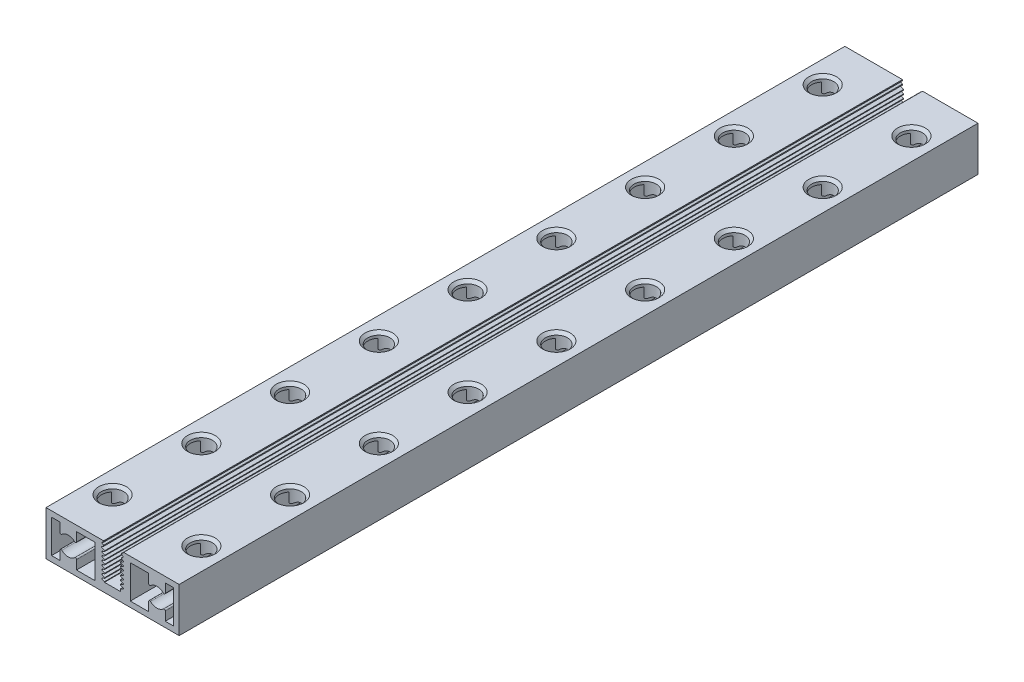
from build123d import *

# Parameters (mm, degrees)
SKETCH1_W                    = 24
SKETCH1_H                    = 144
BOSS_EXTRUDE1_DEPTH          = 8
CUT_EXTRUDE1_DEPTH           = 145.720420121
CUT_EXTRUDE2_DEPTH           = 145.720420121
CUT_EXTRUDE3_DEPTH           = 145.720420121
F_4_0_4_DIAMETER_HOLE1_D     = 4
F_4_0_4_DIAMETER_HOLE1_DEPTH = 10.814359354
CHAMFER1_SIZE                = 0.5
CHAMFER2_SIZE                = 0.168999185
CHAMFER2_PART_2_SIZE         = 0.168999185
CHAMFER2_PART_3_SIZE         = 0.168999185
CHAMFER2_PART_4_SIZE         = 0.168999185
CHAMFER2_PART_5_SIZE         = 0.168999185
CHAMFER2_PART_6_SIZE         = 0.168999185
CHAMFER2_PART_7_SIZE         = 0.168999185
CHAMFER2_PART_8_SIZE         = 0.168999185
CHAMFER2_PART_9_SIZE         = 0.168999185
CHAMFER2_PART_10_SIZE        = 0.168999185
CHAMFER2_PART_11_SIZE        = 0.168999185
CHAMFER2_PART_12_SIZE        = 0.168999185
CHAMFER2_PART_13_SIZE        = 0.168999185
CHAMFER2_PART_14_SIZE        = 0.168999185
CHAMFER2_PART_15_SIZE        = 0.168999185
CHAMFER2_PART_16_SIZE        = 0.168999185
CHAMFER2_PART_17_SIZE        = 0.168999185
CHAMFER2_PART_18_SIZE        = 0.168999185
CHAMFER2_PART_19_SIZE        = 0.168999185
CHAMFER3_SIZE                = 0.175
CHAMFER3_PART_2_SIZE         = 0.175
CHAMFER3_PART_3_SIZE         = 0.175
CHAMFER3_PART_4_SIZE         = 0.175
CHAMFER4_SIZE                = 0.10144029
CHAMFER4_SIZE2               = 0.094749135
CHAMFER5_SIZE                = 0.148675872
CHAMFER5_SIZE2               = 0.159175317


with BuildPart() as part:
    # Sketch1 → Boss-Extrude1 (new body)
    with BuildSketch(Plane(origin=(0, 8, 0), x_dir=(1, 0, 0), z_dir=(0, 1, 0))):
        with Locations((0, -72)):
            Rectangle(SKETCH1_W, SKETCH1_H)
    extrude(amount=-BOSS_EXTRUDE1_DEPTH)

    # Sketch2 → Cut-Extrude1 (cut, through all)
    with BuildSketch(Plane(origin=(0, 0, 0), x_dir=(-1, 0, 0), z_dir=(0, 0, -1))):
        Polygon((1.62, 8), (-2, 8), (-2, 7.88), (-1.468445554, 7.573106898), (-2.074663337, 7.223106898), (-1.468445554, 6.873106898), (-2.087849868, 6.515493651), (-1.240412917, 6.173106898), (-2.106693316, 5.823106898), (-1.240412917, 5.473106898), (-2.106693316, 5.123106898), (-1.240412917, 4.773106898), (-2.106693316, 4.423106898), (-1.240412917, 4.073106898), (-2.106693316, 3.723106898), (-1.240412917, 3.373106898), (-2.106693316, 3.023106898), (-1.240412917, 2.673106898), (-2.106693316, 2.323106898), (-1.46, 2.061825838), (-1.46, 1.6), (1.46, 1.6), (1.46, 1.70121894), (2.106693316, 1.9625), (1.240412917, 2.3125), (2.106693316, 2.6625), (1.240412917, 3.0125), (2.106693316, 3.3625), (1.240412917, 3.7125), (2.106693316, 4.0625), (1.240412917, 4.4125), (2.106693316, 4.7625), (1.240412917, 5.1125), (2.106693316, 5.4625), (1.240412917, 5.8125), (2.106693316, 6.1625), (1.240412917, 6.5125), (2.087849868, 6.854886753), (1.468445554, 7.2125), (2.074663337, 7.5625), (1.62, 7.825), align=None)
    extrude(amount=-CUT_EXTRUDE1_DEPTH, mode=Mode.SUBTRACT)

    # Sketch3 → Cut-Extrude2 (cut, through all)
    with BuildSketch(Plane.XY.offset(144)):
        with BuildLine():
            Line((-6.5, 1), (-3.2, 1))
            Line((-3.2, 1), (-3.2, 7))
            Line((-3.2, 7), (-6.5, 7))
            Line((-6.5, 7), (-6.5, 5.385640646))
            ThreePointArc((-6.5, 5.385640646), (-6.620528059, 5.202108059), (-6.836842105, 5.239783736))
            ThreePointArc((-6.836842105, 5.239783736), (-8, 5.7), (-9.163157895, 5.239783736))
            ThreePointArc((-9.163157895, 5.239783736), (-9.379471941, 5.202108059), (-9.5, 5.385640646))
            Line((-9.5, 5.385640646), (-9.5, 7))
            Line((-9.5, 7), (-11, 7))
            Line((-11, 7), (-11, 1))
            Line((-11, 1), (-9.5, 1))
            Line((-9.5, 1), (-9.5, 2.614359354))
            ThreePointArc((-9.5, 2.614359354), (-9.379471941, 2.797891941), (-9.163157895, 2.760216264))
            ThreePointArc((-9.163157895, 2.760216264), (-8, 2.3), (-6.836842105, 2.760216264))
            ThreePointArc((-6.836842105, 2.760216264), (-6.620528059, 2.797891941), (-6.5, 2.614359354))
            Line((-6.5, 2.614359354), (-6.5, 1))
        make_face()
    extrude(amount=-CUT_EXTRUDE2_DEPTH, mode=Mode.SUBTRACT)

    # Sketch4 → Cut-Extrude3 (cut, through all)
    with BuildSketch(Plane(origin=(0, 0, 0), x_dir=(-1, 0, 0), z_dir=(0, 0, -1))):
        with BuildLine():
            Line((-6.5, 2.614359354), (-6.5, 1))
            Line((-6.5, 1), (-3.2, 1))
            Line((-3.2, 1), (-3.2, 7))
            Line((-3.2, 7), (-6.5, 7))
            Line((-6.5, 7), (-6.5, 5.385640646))
            ThreePointArc((-6.5, 5.385640646), (-6.620528059, 5.202108059), (-6.836842105, 5.239783736))
            ThreePointArc((-6.836842105, 5.239783736), (-8, 5.7), (-9.163157895, 5.239783736))
            ThreePointArc((-9.163157895, 5.239783736), (-9.379471941, 5.202108059), (-9.5, 5.385640646))
            Line((-9.5, 5.385640646), (-9.5, 7))
            Line((-9.5, 7), (-11, 7))
            Line((-11, 7), (-11, 1))
            Line((-11, 1), (-9.5, 1))
            Line((-9.5, 1), (-9.5, 2.614359354))
            ThreePointArc((-9.5, 2.614359354), (-9.379471941, 2.797891941), (-9.163157895, 2.760216264))
            ThreePointArc((-9.163157895, 2.760216264), (-8, 2.3), (-6.836842105, 2.760216264))
            ThreePointArc((-6.836842105, 2.760216264), (-6.620528059, 2.797891941), (-6.5, 2.614359354))
        make_face()
    extrude(amount=-CUT_EXTRUDE3_DEPTH, mode=Mode.SUBTRACT)

    # Ø4.0 (4) Diameter Hole1
    with Locations(Plane(origin=(0, 8, 0), x_dir=(1, 0, 0), z_dir=(0, 1, 0))):
        with Locations((8, -24), (8, -40), (8, -8), (8, -56), (8, -72), (8, -88), (8, -104), (8, -120), (8, -136), (-8, -8), (-8, -24), (-8, -40), (-8, -56), (-8, -72), (-8, -88), (-8, -104), (-8, -120), (-8, -136)):
            Hole(F_4_0_4_DIAMETER_HOLE1_D / 2, depth=F_4_0_4_DIAMETER_HOLE1_DEPTH)

    # Chamfer1
    chamfer1_edges = [part.edges().sort_by_distance(p)[0] for p in [
        (-6, 0, 104),
        (10, 8, 88),
        (-6, 8, 104),
        (-6, 0, 40),
        (-6, 8, 40),
        (10, 8, 24),
        (-6, 0, 8),
        (-6, 0, 72),
        (-6, 0, 136),
        (-6, 8, 72),
        (-6, 8, 136),
        (10, 8, 56),
        (10, 8, 120),
        (-6, 0, 24),
        (-6, 0, 56),
        (-6, 0, 88),
        (-6, 0, 120),
        (-6, 8, 56),
        (-6, 8, 88),
        (-6, 8, 120),
        (10, 8, 8),
        (10, 8, 40),
        (10, 8, 72),
        (10, 8, 104),
        (10, 8, 136),
        (10, 0, 8),
        (10, 0, 24),
        (10, 0, 40),
        (10, 0, 56),
        (10, 0, 72),
        (10, 0, 88),
        (10, 0, 104),
        (10, 0, 120),
        (10, 0, 136),
        (-6, 8, 8),
        (-6, 8, 24),
    ]]
    chamfer(chamfer1_edges, length=CHAMFER1_SIZE)

    # Chamfer2
    chamfer2_edges = [part.edges().sort_by_distance(p)[0] for p in [
        (-1.240412917, 5.1125, 72),
        (-2.106693316, 4.7625, 72),
    ]]
    chamfer(chamfer2_edges, length=CHAMFER2_SIZE)

    # Chamfer2 part 2
    chamfer2_part_2_edges = [part.edges().sort_by_distance(p)[0] for p in [
        (2.106693316, 5.123106898, 72),
    ]]
    chamfer(chamfer2_part_2_edges, length=CHAMFER2_PART_2_SIZE)

    # Chamfer2 part 3
    chamfer2_part_3_edges = [part.edges().sort_by_distance(p)[0] for p in [
        (1.240412917, 4.773106898, 72),
    ]]
    chamfer(chamfer2_part_3_edges, length=CHAMFER2_PART_3_SIZE)

    # Chamfer2 part 4
    chamfer2_part_4_edges = [part.edges().sort_by_distance(p)[0] for p in [
        (-1.240412917, 4.4125, 72),
        (-2.106693316, 4.0625, 72),
    ]]
    chamfer(chamfer2_part_4_edges, length=CHAMFER2_PART_4_SIZE)

    # Chamfer2 part 5
    chamfer2_part_5_edges = [part.edges().sort_by_distance(p)[0] for p in [
        (-2.106693316, 5.4625, 72),
        (-1.240412917, 5.8125, 72),
    ]]
    chamfer(chamfer2_part_5_edges, length=CHAMFER2_PART_5_SIZE)

    # Chamfer2 part 6
    chamfer2_part_6_edges = [part.edges().sort_by_distance(p)[0] for p in [
        (1.240412917, 5.473106898, 72),
    ]]
    chamfer(chamfer2_part_6_edges, length=CHAMFER2_PART_6_SIZE)

    # Chamfer2 part 7
    chamfer2_part_7_edges = [part.edges().sort_by_distance(p)[0] for p in [
        (2.106693316, 4.423106898, 72),
    ]]
    chamfer(chamfer2_part_7_edges, length=CHAMFER2_PART_7_SIZE)

    # Chamfer2 part 8
    chamfer2_part_8_edges = [part.edges().sort_by_distance(p)[0] for p in [
        (2.106693316, 5.823106898, 72),
    ]]
    chamfer(chamfer2_part_8_edges, length=CHAMFER2_PART_8_SIZE)

    # Chamfer2 part 9
    chamfer2_part_9_edges = [part.edges().sort_by_distance(p)[0] for p in [
        (1.240412917, 4.073106898, 72),
    ]]
    chamfer(chamfer2_part_9_edges, length=CHAMFER2_PART_9_SIZE)

    # Chamfer2 part 10
    chamfer2_part_10_edges = [part.edges().sort_by_distance(p)[0] for p in [
        (-1.240412917, 3.7125, 72),
        (-2.106693316, 3.3625, 72),
    ]]
    chamfer(chamfer2_part_10_edges, length=CHAMFER2_PART_10_SIZE)

    # Chamfer2 part 11
    chamfer2_part_11_edges = [part.edges().sort_by_distance(p)[0] for p in [
        (-2.106693316, 6.1625, 72),
        (-1.240412917, 6.5125, 72),
    ]]
    chamfer(chamfer2_part_11_edges, length=CHAMFER2_PART_11_SIZE)

    # Chamfer2 part 12
    chamfer2_part_12_edges = [part.edges().sort_by_distance(p)[0] for p in [
        (1.240412917, 6.173106898, 72),
    ]]
    chamfer(chamfer2_part_12_edges, length=CHAMFER2_PART_12_SIZE)

    # Chamfer2 part 13
    chamfer2_part_13_edges = [part.edges().sort_by_distance(p)[0] for p in [
        (2.106693316, 3.723106898, 72),
    ]]
    chamfer(chamfer2_part_13_edges, length=CHAMFER2_PART_13_SIZE)

    # Chamfer2 part 14
    chamfer2_part_14_edges = [part.edges().sort_by_distance(p)[0] for p in [
        (1.240412917, 3.373106898, 72),
    ]]
    chamfer(chamfer2_part_14_edges, length=CHAMFER2_PART_14_SIZE)

    # Chamfer2 part 15
    chamfer2_part_15_edges = [part.edges().sort_by_distance(p)[0] for p in [
        (-1.240412917, 3.0125, 72),
        (-2.106693316, 2.6625, 72),
    ]]
    chamfer(chamfer2_part_15_edges, length=CHAMFER2_PART_15_SIZE)

    # Chamfer2 part 16
    chamfer2_part_16_edges = [part.edges().sort_by_distance(p)[0] for p in [
        (2.106693316, 3.023106898, 72),
    ]]
    chamfer(chamfer2_part_16_edges, length=CHAMFER2_PART_16_SIZE)

    # Chamfer2 part 17
    chamfer2_part_17_edges = [part.edges().sort_by_distance(p)[0] for p in [
        (1.240412917, 2.673106898, 72),
    ]]
    chamfer(chamfer2_part_17_edges, length=CHAMFER2_PART_17_SIZE)

    # Chamfer2 part 18
    chamfer2_part_18_edges = [part.edges().sort_by_distance(p)[0] for p in [
        (-1.240412917, 2.3125, 72),
        (-2.106693316, 1.9625, 72),
    ]]
    chamfer(chamfer2_part_18_edges, length=CHAMFER2_PART_18_SIZE)

    # Chamfer2 part 19
    chamfer2_part_19_edges = [part.edges().sort_by_distance(p)[0] for p in [
        (2.106693316, 2.323106898, 72),
    ]]
    chamfer(chamfer2_part_19_edges, length=CHAMFER2_PART_19_SIZE)

    # Chamfer3
    chamfer3_edges = [part.edges().sort_by_distance(p)[0] for p in [
        (1.468445554, 6.873106898, 72),
    ]]
    chamfer(chamfer3_edges, length=CHAMFER3_SIZE)

    # Chamfer3 part 2
    chamfer3_part_2_edges = [part.edges().sort_by_distance(p)[0] for p in [
        (-1.468445554, 7.2125, 72),
    ]]
    chamfer(chamfer3_part_2_edges, length=CHAMFER3_PART_2_SIZE)

    # Chamfer3 part 3
    chamfer3_part_3_edges = [part.edges().sort_by_distance(p)[0] for p in [
        (2.074663337, 7.223106898, 72),
        (1.468445554, 7.573106898, 72),
    ]]
    chamfer(chamfer3_part_3_edges, length=CHAMFER3_PART_3_SIZE)

    # Chamfer3 part 4
    chamfer3_part_4_edges = [part.edges().sort_by_distance(p)[0] for p in [
        (-2.074663337, 7.5625, 72),
    ]]
    chamfer(chamfer3_part_4_edges, length=CHAMFER3_PART_4_SIZE)

    # Chamfer4
    chamfer4_edges = [part.edges().sort_by_distance(p)[0] for p in [
        (-2.087849868, 6.854886753, 72),
    ]]
    chamfer4_side = [part.faces().sort_by_distance(p)[0] for p in [
        (-1.853924934, 6.989943376, 72),
    ]]
    chamfer(chamfer4_edges, length=CHAMFER4_SIZE, length2=CHAMFER4_SIZE2, reference=chamfer4_side[0])

    # Chamfer5
    chamfer5_edges = [part.edges().sort_by_distance(p)[0] for p in [
        (2.087849868, 6.515493651, 72),
    ]]
    chamfer5_side = [part.faces().sort_by_distance(p)[0] for p in [
        (1.74247805, 6.375954379, 72),
    ]]
    chamfer(chamfer5_edges, length=CHAMFER5_SIZE, length2=CHAMFER5_SIZE2, reference=chamfer5_side[0])


solid = part.part
